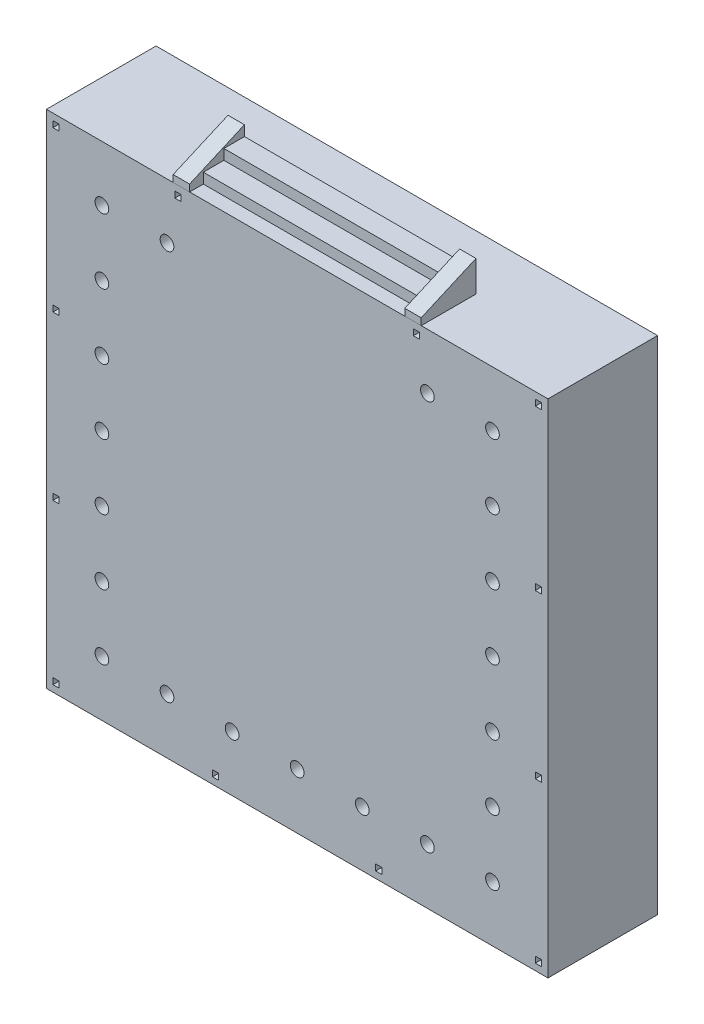
from build123d import *

# Parameters (mm, degrees)
SKETCH_1_W          = 7320
SKETCH_1_H          = 7320
EXTRUDE_1_DEPTH     = 1600
SKETCH_2_R          = 100
CUT_EXTRUDE_2_DEPTH = 150
OTHER_START         = -495.231530838
OTHER_3_DEPTH       = 3620
OTHER_3_2_DEPTH     = 240
OTHER_START_2       = 2884.768469162
OTHER_3_3_DEPTH     = 240
SKETCH_9_W          = 90
SKETCH_9_H          = 90
CUT_EXTRUDE_3_DEPTH = 150
SKETCH_10_R         = 100
CUT_EXTRUDE_4_DEPTH = 150


# Read off the part's stored shape, not the designer's step: 零件3
with BuildPart() as part:
    # 草图1 → 凸台-拉伸1 (new body)
    with BuildSketch(Plane.XY):
        with Locations((1314.768469162, 2698.045948238)):
            Rectangle(SKETCH_1_W, SKETCH_1_H)
    extrude(amount=-EXTRUDE_1_DEPTH)

    # 草图2 → 切除-拉伸2 (cut)
    with BuildSketch(Plane.XY):
        with Locations((-1535.231530838, 5548.045948238)):
            Circle(SKETCH_2_R)
        with Locations((4164.768469162, 5548.045948238)):
            Circle(SKETCH_2_R)
        with Locations((-1535.231530838, -151.954051762)):
            Circle(SKETCH_2_R)
        with Locations((4164.768469162, -151.954051762)):
            Circle(SKETCH_2_R)
    extrude(amount=-CUT_EXTRUDE_2_DEPTH, mode=Mode.SUBTRACT)

    # 草图9 → 切除-拉伸3 (cut)
    with BuildSketch(Plane.XY):
        with Locations((-2205.231530838, 6218.045948238)):
            Rectangle(SKETCH_9_W, SKETCH_9_H)
        with Locations((-2205.231530838, 3888.045948238)):
            Rectangle(SKETCH_9_W, SKETCH_9_H)
        with Locations((-2205.231530838, 1508.045948238)):
            Rectangle(SKETCH_9_W, SKETCH_9_H)
        with Locations((-2205.231530838, -821.954051762)):
            Rectangle(SKETCH_9_W, SKETCH_9_H)
        with Locations((124.768469162, -821.954051762)):
            Rectangle(SKETCH_9_W, SKETCH_9_H)
        with Locations((2504.768469162, -821.954051762)):
            Rectangle(SKETCH_9_W, SKETCH_9_H)
        with Locations((4834.768469162, -821.954051762)):
            Rectangle(SKETCH_9_W, SKETCH_9_H)
        with Locations((4834.768469162, 1508.045948238)):
            Rectangle(SKETCH_9_W, SKETCH_9_H)
        with Locations((4834.768469162, 3888.045948238)):
            Rectangle(SKETCH_9_W, SKETCH_9_H)
        with Locations((4834.768469162, 6218.045948238)):
            Rectangle(SKETCH_9_W, SKETCH_9_H)
        with Locations((3054.768469162, 6218.045948238)):
            Rectangle(SKETCH_9_W, SKETCH_9_H)
        with Locations((-425.231530838, 6218.045948238)):
            Rectangle(SKETCH_9_W, SKETCH_9_H)
    extrude(amount=-CUT_EXTRUDE_3_DEPTH, mode=Mode.SUBTRACT)

    # 草图10 → 切除-拉伸4 (cut)
    with BuildSketch(Plane.XY):
        with Locations((-585.231530838, 5548.045948238)):
            Circle(SKETCH_10_R)
        with Locations((-1535.231530838, 3648.045948238)):
            Circle(SKETCH_10_R)
        with Locations((-1535.231530838, 1748.045948238)):
            Circle(SKETCH_10_R)
        with Locations((4164.768469162, 3648.045948238)):
            Circle(SKETCH_10_R)
        with Locations((4164.768469162, 1748.045948238)):
            Circle(SKETCH_10_R)
        with Locations((3214.768469162, 5548.045948238)):
            Circle(SKETCH_10_R)
        with Locations((-1535.231530838, 4598.045948238)):
            Circle(SKETCH_10_R)
        with Locations((-1535.231530838, 2698.045948238)):
            Circle(SKETCH_10_R)
        with Locations((-1535.231530838, 798.045948238)):
            Circle(SKETCH_10_R)
        with Locations((4164.768469162, 4598.045948238)):
            Circle(SKETCH_10_R)
        with Locations((4164.768469162, 2698.045948238)):
            Circle(SKETCH_10_R)
        with Locations((4164.768469162, 798.045948238)):
            Circle(SKETCH_10_R)
        with Locations((-585.231530838, -151.954051762)):
            Circle(SKETCH_10_R)
        with Locations((364.768469162, -151.954051762)):
            Circle(SKETCH_10_R)
        with Locations((1314.768469162, -151.954051762)):
            Circle(SKETCH_10_R)
        with Locations((2264.768469162, -151.954051762)):
            Circle(SKETCH_10_R)
        with Locations((3214.768469162, -151.954051762)):
            Circle(SKETCH_10_R)
    extrude(amount=-CUT_EXTRUDE_4_DEPTH, mode=Mode.SUBTRACT)


with BuildPart() as body_2:
    # Other 3 outline → Other 3 (new body)
    with BuildSketch(Plane.YZ.offset(OTHER_START)):
        Polygon((6658.045948238, -800), (6658.045948238, -500), (6508.045948238, -500), (6508.045948238, -200), (6358.045948238, -200), (6358.045948238, -800), align=None)
    extrude(amount=OTHER_3_DEPTH)

    # Other 3 2 outline → Other 3 2 (add)
    with BuildSketch(Plane.YZ.offset(OTHER_START)):
        Polygon((6508.045948238, -500), (6658.045948238, -500), (6658.045948238, -800), (6808.045948238, -800), (6458.045948238, 0), (6358.045948238, 0), (6358.045948238, -200), (6508.045948238, -200), align=None)
    extrude(amount=OTHER_3_2_DEPTH)

    # Other 3 3 outline → Other 3 3 (add)
    with BuildSketch(Plane.YZ.offset(OTHER_START_2)):
        Polygon((6508.045948238, -500), (6658.045948238, -500), (6658.045948238, -800), (6808.045948238, -800), (6458.045948238, 0), (6358.045948238, 0), (6358.045948238, -200), (6508.045948238, -200), align=None)
    extrude(amount=OTHER_3_3_DEPTH)


solid = Compound([part.part, body_2.part])
